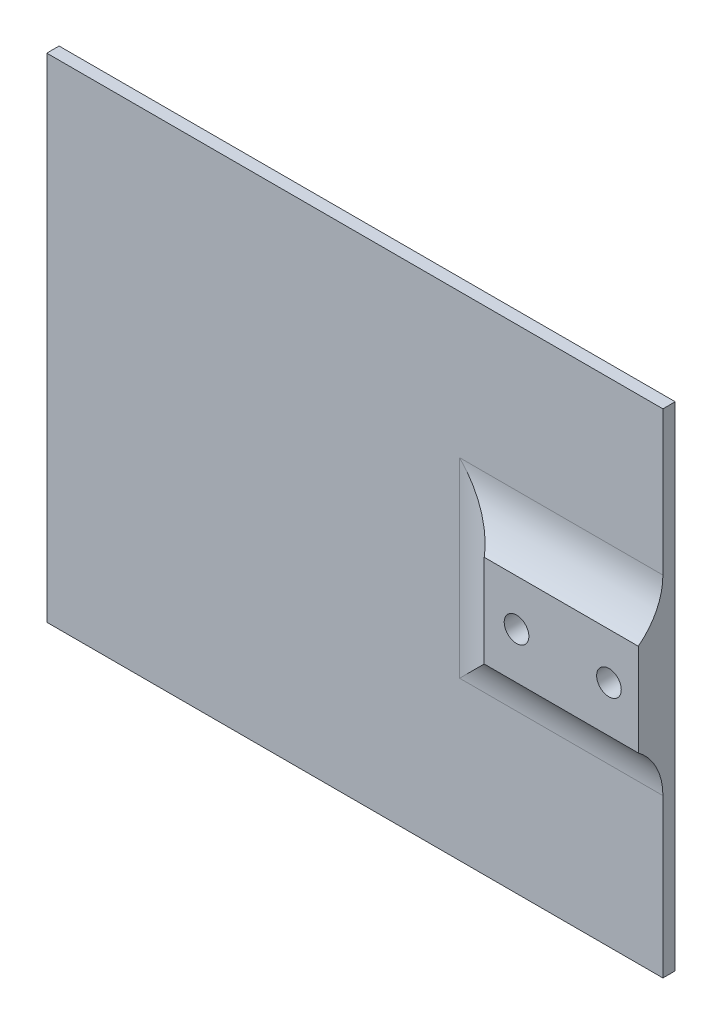
from build123d import *

# Parameters (mm, degrees)
SKETCH1_W           = 100
SKETCH1_H           = 80
BOSS_EXTRUDE1_DEPTH = 2
SKETCH2_W           = 25
SKETCH2_H           = 15
BOSS_EXTRUDE2_DEPTH = 4
SKETCH3_R           = 2
CUT_EXTRUDE1_DEPTH  = 129.202964084
FILLET1_R           = 10


with BuildPart() as part:
    # Sketch1 → Boss-Extrude1 (new body)
    with BuildSketch(Plane.XY):
        with Locations((50, 40)):
            Rectangle(SKETCH1_W, SKETCH1_H)
    extrude(amount=BOSS_EXTRUDE1_DEPTH)

    # Sketch2 → Boss-Extrude2 (add)
    with BuildSketch(Plane.XY.offset(2)):
        with Locations((87.5, 41.137045181)):
            Rectangle(SKETCH2_W, SKETCH2_H)
    extrude(amount=BOSS_EXTRUDE2_DEPTH)

    # Sketch3 → Cut-Extrude1 (cut, through all)
    with BuildSketch(Plane.XY.offset(6)):
        with Locations((80.242914422, 41.137045181)):
            Circle(SKETCH3_R)
        with Locations((95.242914422, 41.137045181)):
            Circle(SKETCH3_R)
    extrude(amount=-CUT_EXTRUDE1_DEPTH, mode=Mode.SUBTRACT)

    # Fillet1
    # the kernel refuses this fillet: 10 mm, written as the material it adds along each edge
    with BuildSketch(Plane(origin=(75, 48.637045181, 2), x_dir=(0, 1, 0), z_dir=(1, 0, 0)), Plane(origin=(100, 33.637045181, 2), x_dir=(0, -1, 0), z_dir=(-1, 0, 0))) as fillet1_piece_1:
        with BuildLine():
            CenterArc((8, 10), FILLET1_R, 216.869897646, 53.130102354)
            Line((0, 4), (-0.16, 3.88))
            ThreePointArc((-0.16, 3.88), (-0.2, 2), (-0.2, 0))
            Line((-0.2, 0), (0, -0.2))
            Line((0, -0.2), (8, -0.2))
            Line((8, -0.2), (8, 0))
        make_face()
    extrude(amount=25)
    with BuildSketch(Plane(origin=(75, 33.637045181, 2), x_dir=(-1, 0, 0), z_dir=(0, 1, 0))) as fillet1_piece_2:
        with BuildLine():
            CenterArc((8, 10), FILLET1_R, 216.869897646, 53.130102354)
            Line((0, 4), (-0.16, 3.88))
            ThreePointArc((-0.16, 3.88), (-0.2, 2), (-0.2, 0))
            Line((-0.2, 0), (0, -0.2))
            Line((0, -0.2), (8, -0.2))
            Line((8, -0.2), (8, 0))
        make_face()
    extrude(amount=15)
    with BuildSketch(Plane(origin=(55, 48.637045181, 2), x_dir=(0, 1, 0), z_dir=(1, 0, 0))) as fillet1_piece_3a_section:
        with BuildLine():
            CenterArc((8, 10), FILLET1_R, 216.869897646, 53.130102354)
            Line((0, 4), (-0.16, 3.88))
            ThreePointArc((-0.16, 3.88), (-0.2, 2), (-0.2, 0))
            Line((-0.2, 0), (0, -0.2))
            Line((0, -0.2), (8, -0.2))
            Line((8, -0.2), (8, 0))
        make_face()
    fillet1_piece_3a = extrude(amount=45, mode=Mode.PRIVATE)
    fillet1_piece_3a = split(fillet1_piece_3a, bisect_by=Plane(origin=(75, 50.695879295, 3.023885124), z_dir=(-1, 0, 0)), keep=Keep.TOP, mode=Mode.PRIVATE)
    with BuildSketch(Plane(origin=(75, 33.637045181, 2), x_dir=(-1, 0, 0), z_dir=(0, 1, 0))) as fillet1_piece_3b_section:
        with BuildLine():
            CenterArc((8, 10), FILLET1_R, 216.869897646, 53.130102354)
            Line((0, 4), (-0.16, 3.88))
            ThreePointArc((-0.16, 3.88), (-0.2, 2), (-0.2, 0))
            Line((-0.2, 0), (0, -0.2))
            Line((0, -0.2), (8, -0.2))
            Line((8, -0.2), (8, 0))
        make_face()
    fillet1_piece_3b = extrude(amount=35, mode=Mode.PRIVATE)
    fillet1_piece_3b = split(fillet1_piece_3b, bisect_by=Plane(origin=(72.941165886, 48.637045181, 3.023885124), z_dir=(0, 1, 0)), keep=Keep.TOP, mode=Mode.PRIVATE)
    fillet1_piece_3 = fillet1_piece_3a & fillet1_piece_3b
    add(fillet1_piece_3)
    with BuildSketch(Plane(origin=(75, 13.637045181, 2), x_dir=(-1, 0, 0), z_dir=(0, 1, 0))) as fillet1_piece_4a_section:
        with BuildLine():
            CenterArc((8, 10), FILLET1_R, 216.869897646, 53.130102354)
            Line((0, 4), (-0.16, 3.88))
            ThreePointArc((-0.16, 3.88), (-0.2, 2), (-0.2, 0))
            Line((-0.2, 0), (0, -0.2))
            Line((0, -0.2), (8, -0.2))
            Line((8, -0.2), (8, 0))
        make_face()
    fillet1_piece_4a = extrude(amount=35, mode=Mode.PRIVATE)
    fillet1_piece_4a = split(fillet1_piece_4a, bisect_by=Plane(origin=(72.941165886, 33.637045181, 3.023885124), z_dir=(0, -1, 0)), keep=Keep.TOP, mode=Mode.PRIVATE)
    with BuildSketch(Plane(origin=(100, 33.637045181, 2), x_dir=(0, -1, 0), z_dir=(-1, 0, 0))) as fillet1_piece_4b_section:
        with BuildLine():
            CenterArc((8, 10), FILLET1_R, 216.869897646, 53.130102354)
            Line((0, 4), (-0.16, 3.88))
            ThreePointArc((-0.16, 3.88), (-0.2, 2), (-0.2, 0))
            Line((-0.2, 0), (0, -0.2))
            Line((0, -0.2), (8, -0.2))
            Line((8, -0.2), (8, 0))
        make_face()
    fillet1_piece_4b = extrude(amount=45, mode=Mode.PRIVATE)
    fillet1_piece_4b = split(fillet1_piece_4b, bisect_by=Plane(origin=(75, 31.578211067, 3.023885124), z_dir=(-1, 0, 0)), keep=Keep.TOP, mode=Mode.PRIVATE)
    fillet1_piece_4 = fillet1_piece_4a & fillet1_piece_4b
    add(fillet1_piece_4)


solid = part.part
